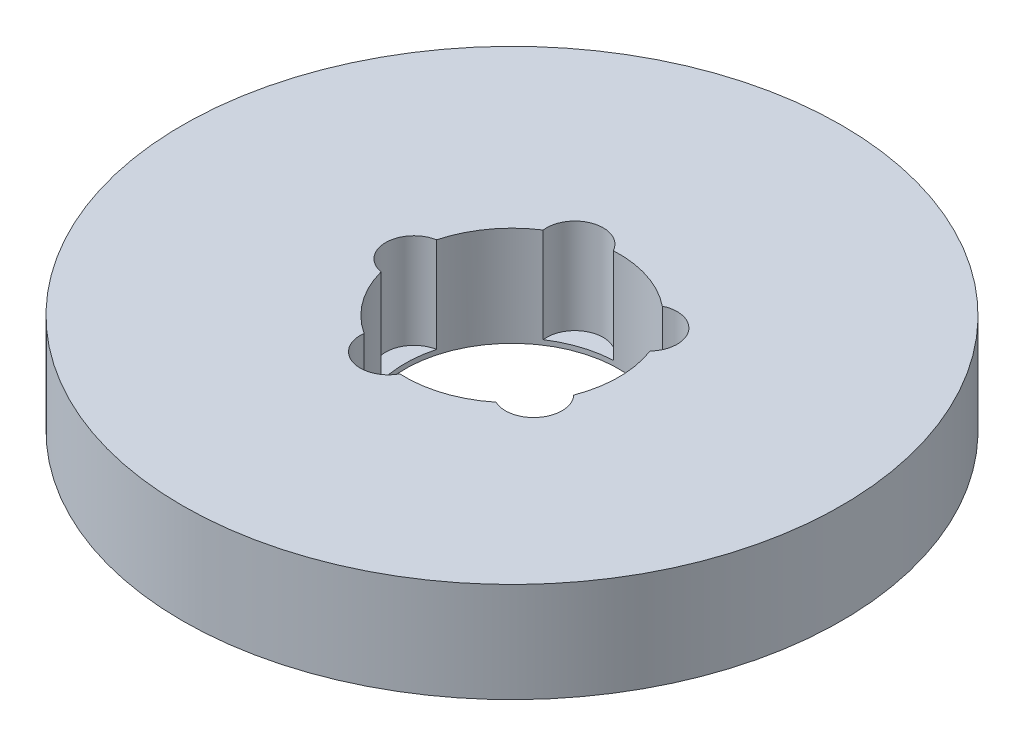
from build123d import *

# Parameters (mm, degrees)
SKETCH1_R           = 92.5
BOSS_EXTRUDE1_DEPTH = 28
SKETCH2_R           = 30
CUT_EXTRUDE1_DEPTH  = 134.777800849
SKETCH3_R           = 7.942321069
CUT_EXTRUDE2_DEPTH  = 26.647954133
CIRPATTERN1_COUNT   = 5


with BuildPart() as part:
    # Sketch1 → Boss-Extrude1 (new body)
    with BuildSketch(Plane(origin=(0, 0, 0), x_dir=(1, 0, 0), z_dir=(0, 1, 0))):
        Circle(SKETCH1_R)
    extrude(amount=BOSS_EXTRUDE1_DEPTH)

    # Sketch2 → Cut-Extrude1 (cut, through all)
    with BuildSketch(Plane(origin=(0, 0, 0), x_dir=(1, 0, 0), z_dir=(0, 1, 0))):
        Circle(SKETCH2_R)
    extrude(amount=CUT_EXTRUDE1_DEPTH, mode=Mode.SUBTRACT)

    # Sketch3 → Cut-Extrude2 (cut)
    with BuildSketch(Plane(origin=(0, 28, 0), x_dir=(1, 0, 0), z_dir=(0, 1, 0))):
        with Locations((-27.510420927, 0)):
            Circle(SKETCH3_R)
    cut_extrude2 = extrude(amount=-CUT_EXTRUDE2_DEPTH, mode=Mode.SUBTRACT)

    # CirPattern1: Cut-Extrude2 ×5 about axis
    cirpattern1_axis = Axis((0, 0, 0), (0, 1, 0))
    for i in range(1, CIRPATTERN1_COUNT):
        add(cut_extrude2.rotate(cirpattern1_axis, i * 360 / CIRPATTERN1_COUNT), mode=Mode.SUBTRACT)


solid = part.part
